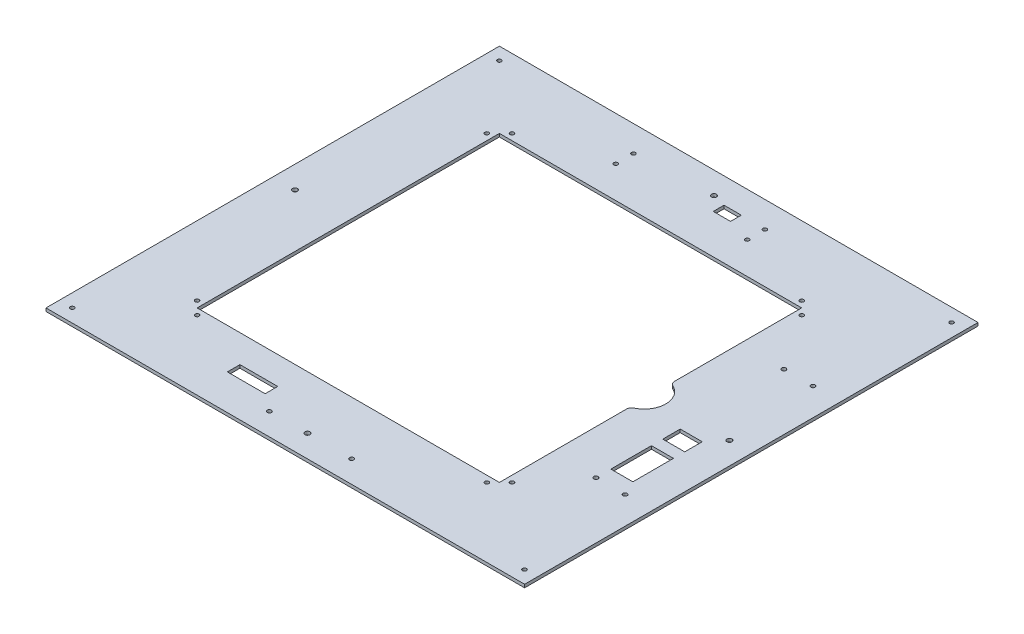
from build123d import *

# Parameters (mm, degrees)
SKETCH1_W           = 482.6
SKETCH1_H           = 457.2
SKETCH1_R           = 2
SKETCH1_W_2         = 38.1
SKETCH1_H_2         = 12.7
SKETCH1_R_2         = 2.1
SKETCH1_R_3         = 2.54
SKETCH1_R_4         = 2.159
SKETCH1_R_5         = 2.0955
SKETCH1_W_3         = 22.197164078
SKETCH1_H_3         = 40.943496447
SKETCH1_H_4         = 17.6350312
SKETCH1_W_4         = 17.438820998
SKETCH1_H_5         = 10.883645004
BOSS_EXTRUDE1_DEPTH = 3.175
FILLET2_R           = 5


with BuildPart() as part:
    # Sketch1 → Boss-Extrude1 (new body)
    with BuildSketch(Plane(origin=(0, 0, 0), x_dir=(1, 0, 0), z_dir=(0, 1, 0))):
        with Locations((-1.251503591, 0)):
            Rectangle(SKETCH1_W, SKETCH1_H)
        with Locations((-229.375503591, -215.2716)):
            Circle(SKETCH1_R, mode=Mode.SUBTRACT)
        with Locations((-160.033503591, -158.782)):
            Circle(SKETCH1_R, mode=Mode.SUBTRACT)
        with Locations((-172.733503591, -146.082)):
            Circle(SKETCH1_R, mode=Mode.SUBTRACT)
        with Locations((-76.181503591, -186.695610311)):
            Rectangle(SKETCH1_W_2, SKETCH1_H_2, mode=Mode.SUBTRACT)
        with Locations((-39.643603591, -206.2861)):
            Circle(SKETCH1_R_2, mode=Mode.SUBTRACT)
        with Locations((-1.291503591, -206.2372)):
            Circle(SKETCH1_R_3, mode=Mode.SUBTRACT)
        with BuildLine():
            Line((-166.351503591, -152.4), (-166.351503591, 152.4))
            Line((-166.351503591, 152.4), (138.448496409, 152.4))
            Line((138.448496409, 152.4), (138.448496409, 20.741284059))
            ThreePointArc((138.448496409, 20.741284059), (153.790046939, 0), (138.448496409, -20.741284059))
            Line((138.448496409, -20.741284059), (138.448496409, -152.4))
            Line((138.448496409, -152.4), (-140.951503591, -152.4))
            Line((-140.951503591, -152.4), (-166.351503591, -152.4))
        make_face(mode=Mode.SUBTRACT)
        with Locations((43.338196409, -206.2861)):
            Circle(SKETCH1_R_2, mode=Mode.SUBTRACT)
        with Locations((227.228096409, -215.9066)):
            Circle(SKETCH1_R, mode=Mode.SUBTRACT)
        with Locations((132.130496409, -158.782)):
            Circle(SKETCH1_R, mode=Mode.SUBTRACT)
        with Locations((144.830496409, -146.082)):
            Circle(SKETCH1_R, mode=Mode.SUBTRACT)
        with Locations((182.985353882, -99.579800078)):
            Circle(SKETCH1_R_4, mode=Mode.SUBTRACT)
        with Locations((212.390436409, -99.579800078)):
            Circle(SKETCH1_R_5, mode=Mode.SUBTRACT)
        with Locations((194.083935921, -64.08358634)):
            Rectangle(SKETCH1_W_3, SKETCH1_H_3, mode=Mode.SUBTRACT)
        with Locations((194.083935921, -23.429524632)):
            Rectangle(SKETCH1_W_3, SKETCH1_H_4, mode=Mode.SUBTRACT)
        with Locations((-220.087103591, 0)):
            Circle(SKETCH1_R_3, mode=Mode.SUBTRACT)
        with Locations((-172.733503591, 146.082)):
            Circle(SKETCH1_R, mode=Mode.SUBTRACT)
        with Locations((-160.033503591, 158.782)):
            Circle(SKETCH1_R, mode=Mode.SUBTRACT)
        with Locations((-229.832703591, 215.8812)):
            Circle(SKETCH1_R, mode=Mode.SUBTRACT)
        with Locations((-81.109103591, 184.531)):
            Circle(SKETCH1_R, mode=Mode.SUBTRACT)
        with Locations((-81.109103591, 202.311)):
            Circle(SKETCH1_R, mode=Mode.SUBTRACT)
        with Locations((-3.831503591, 206.2626)):
            Circle(SKETCH1_R_3, mode=Mode.SUBTRACT)
        with Locations((217.711096409, 0.294)):
            Circle(SKETCH1_R_3, mode=Mode.SUBTRACT)
        with Locations((182.985353882, 89.827999922)):
            Circle(SKETCH1_R_4, mode=Mode.SUBTRACT)
        with Locations((212.390436409, 89.827999922)):
            Circle(SKETCH1_R_5, mode=Mode.SUBTRACT)
        with Locations((18.318465636, 197.512214728)):
            Rectangle(SKETCH1_W_4, SKETCH1_H_5, mode=Mode.SUBTRACT)
        with Locations((51.351896409, 184.531)):
            Circle(SKETCH1_R, mode=Mode.SUBTRACT)
        with Locations((51.351896409, 202.311)):
            Circle(SKETCH1_R, mode=Mode.SUBTRACT)
        with Locations((144.830496409, 146.082)):
            Circle(SKETCH1_R, mode=Mode.SUBTRACT)
        with Locations((132.130496409, 158.782)):
            Circle(SKETCH1_R, mode=Mode.SUBTRACT)
        with Locations((226.720096409, 215.2716)):
            Circle(SKETCH1_R, mode=Mode.SUBTRACT)
    extrude(amount=BOSS_EXTRUDE1_DEPTH)

    # Fillet2
    fillet2_edges = [part.edges().sort_by_distance(p)[0] for p in [
        (138.448496409, 1.5875, 20.741284059),
        (138.448496409, 1.5875, -20.741284059),
    ]]
    fillet(fillet2_edges, radius=FILLET2_R)


solid = part.part
